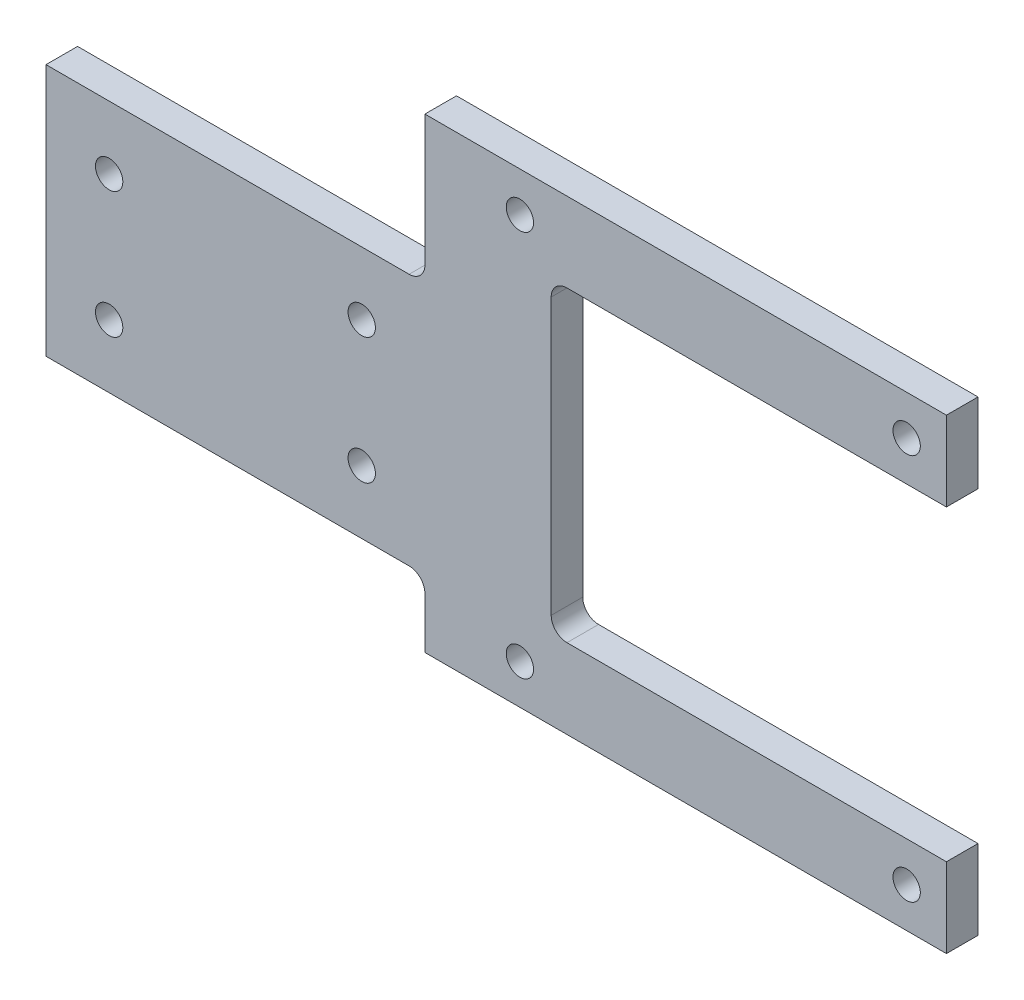
from build123d import *

# Parameters (mm, degrees)
BOSS_EXTRUDE1_DEPTH      = 6.35
M5_CLEARANCE_HOLE1_D     = 5.5
M5_CLEARANCE_HOLE1_DEPTH = 18.75
M5_CLEARANCE_HOLE1_TIP   = 1.652366702
FILLET1_R                = 3.175
M5_CLEARANCE_HOLE2_D     = 5.5
M5_CLEARANCE_HOLE2_DEPTH = 18.75
M5_CLEARANCE_HOLE2_TIP   = 1.652366702


with BuildPart() as part:
    # Sketch1 → Boss-Extrude1 (new body)
    with BuildSketch(Plane.XY):
        Polygon((38.1, 25.4), (38.1, 54.890872965), (142.990872965, 54.890872965), (142.990872965, 38.890872965), (63.5, 38.890872965), (63.5, -22.890872965), (142.990872965, -22.890872965), (142.990872965, -38.890872965), (38.1, -38.890872965), (38.1, -25.4), (-38.1, -25.4), (-38.1, 25.4), align=None)
    extrude(amount=BOSS_EXTRUDE1_DEPTH)

    # M5 Clearance Hole1
    with Locations(Plane.XY.offset(6.35)):
        with Locations((134.990872965, 46.890872965), (134.990872965, -30.890872965), (57.209127035, 46.890872965), (57.209127035, -30.890872965)):
            Hole(M5_CLEARANCE_HOLE1_D / 2, depth=M5_CLEARANCE_HOLE1_DEPTH)
            with Locations((0, 0, -(M5_CLEARANCE_HOLE1_DEPTH + M5_CLEARANCE_HOLE1_TIP / 2))):  # 118° drill point
                Cone(0, M5_CLEARANCE_HOLE1_D / 2, M5_CLEARANCE_HOLE1_TIP, mode=Mode.SUBTRACT)

    # Fillet1
    fillet1_edges = [part.edges().sort_by_distance(p)[0] for p in [
        (63.5, 38.890872965, 3.175),
        (63.5, -22.890872965, 3.175),
        (38.1, -25.4, 3.175),
        (38.1, 25.4, 3.175),
    ]]
    fillet(fillet1_edges, radius=FILLET1_R)

    # M5 Clearance Hole2
    with Locations(Plane.XY.offset(6.35)):
        with Locations((-25.4, 12.7), (25.4, 12.7), (25.4, -12.7), (-25.4, -12.7)):
            Hole(M5_CLEARANCE_HOLE2_D / 2, depth=M5_CLEARANCE_HOLE2_DEPTH)
            with Locations((0, 0, -(M5_CLEARANCE_HOLE2_DEPTH + M5_CLEARANCE_HOLE2_TIP / 2))):  # 118° drill point
                Cone(0, M5_CLEARANCE_HOLE2_D / 2, M5_CLEARANCE_HOLE2_TIP, mode=Mode.SUBTRACT)


solid = part.part
